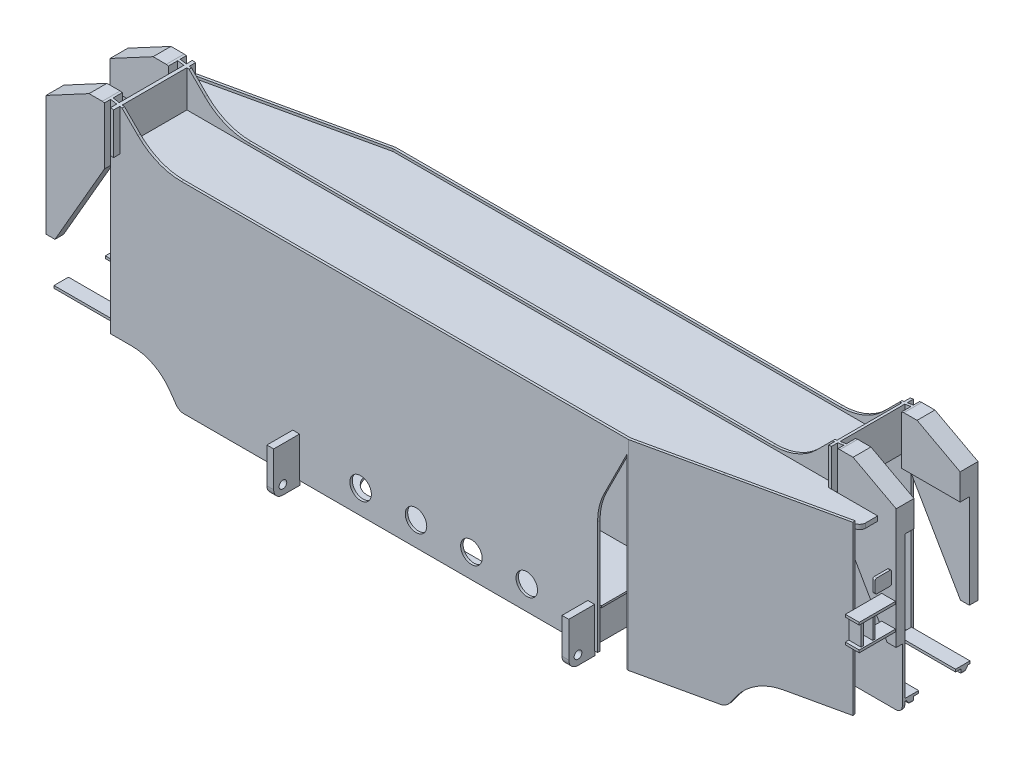
from build123d import *

# Parameters (mm, degrees)
EXTRUDE_1_DEPTH      = 8
SKETCH_4_R           = 35.00000000000003
SKETCH_4_R_2         = 34.99999999999992
SKETCH_4_R_3         = 20.250000000000004
SKETCH_4_R_4         = 20.24999999999988
SKETCH_4_R_5         = 10.499999999999998
SKETCH_4_R_6         = 10.499999999999954
CUT_EXTRUDE_2_DEPTH  = 8
EXTRUDE_2_DEPTH      = 8
SKETCH_8_R           = 34.99999999999992
CUT_EXTRUDE_4_DEPTH  = 8
EXTRUDE_3_DEPTH      = 8
SKETCH_12_R          = 34.99999999999992
CUT_EXTRUDE_6_DEPTH  = 8
EXTRUDE_4_DEPTH      = 650
EXTRUDE_5_DEPTH      = 650
EXTRUDE_6_DEPTH      = 15
EXTRUDE_7_DEPTH      = 15
SKETCH_20_W          = 1294.5
SKETCH_20_H          = 210.00000000000003
EXTRUDE_8_DEPTH      = 8
SKETCH_22_R          = 60.00000000000006
SKETCH_22_R_2        = 59.99999999999983
CUT_EXTRUDE_8_DEPTH  = 8
SKETCH_23_W          = 1294.5000000000002
SKETCH_23_H          = 210.00000000000003
EXTRUDE_9_DEPTH      = 8
SKETCH_24_R          = 60.00000000000006
SKETCH_24_R_2        = 59.99999999999994
CUT_EXTRUDE_9_DEPTH  = 8
SKETCH_26_W          = 944.0000000000002
SKETCH_26_H          = 210.00000000000003
EXTRUDE_10_DEPTH     = 6
SKETCH_27_W          = 944.0000000000001
SKETCH_27_H          = 210.00000000000003
EXTRUDE_11_DEPTH     = 6
EXTRUDE_12_DEPTH     = 20
EXTRUDE_13_DEPTH     = 20
EXTRUDE_14_DEPTH     = 20
EXTRUDE_15_DEPTH     = 20
EXTRUDE_16_DEPTH     = 8
EXTRUDE_17_DEPTH     = 8
EXTRUDE_18_DEPTH     = 30
EXTRUDE_19_DEPTH     = 30
EXTRUDE_20_DEPTH     = 30
EXTRUDE_21_DEPTH     = 30
EXTRUDE_22_DEPTH     = 346.3065
CUT_EXTRUDE_11_DEPTH = 12
EXTRUDE_23_DEPTH     = 346.3065
CUT_EXTRUDE_12_DEPTH = 12
SKETCH_51_W          = 190
SKETCH_51_H          = 46.99999999999997
SKETCH_51_H_2        = 47
SKETCH_51_W_2        = 617.2920000000001
EXTRUDE_24_DEPTH     = 8
SKETCH_52_W          = 617.2919999999997
SKETCH_52_H          = 47.00000000000003
SKETCH_52_H_2        = 47
SKETCH_52_W_2        = 190
EXTRUDE_25_DEPTH     = 8
EXTRUDE_26_DEPTH     = 319
EXTRUDE_27_DEPTH     = 319
EXTRUDE_28_DEPTH     = 319
EXTRUDE_29_DEPTH     = 319
SKETCH_60_W          = 2705
SKETCH_60_H          = 940.0000000000001
CUT_EXTRUDE_14_DEPTH = 600
SKETCH_62_W          = 214.00000000000003
SKETCH_62_H          = 109
EXTRUDE_30_DEPTH     = 22
SKETCH_64_R          = 12.499999999999956
CUT_EXTRUDE_16_DEPTH = 22
SKETCH_66_W          = 214.00000000000003
SKETCH_66_H          = 109
EXTRUDE_31_DEPTH     = 22
SKETCH_68_R          = 12.499999999999956
CUT_EXTRUDE_18_DEPTH = 22
SKETCH_70_W          = 118.00000000000001
SKETCH_70_H          = 8
EXTRUDE_32_DEPTH     = 45
SKETCH_72_W          = 8
SKETCH_72_H          = 70.00000000000006
EXTRUDE_33_DEPTH     = 40
SKETCH_74_W          = 118
SKETCH_74_H          = 8
EXTRUDE_34_DEPTH     = 45
SKETCH_75_W          = 8
SKETCH_75_H          = 70.00000000000006
EXTRUDE_35_DEPTH     = 40
EXTRUDE_36_DEPTH     = 8
EXTRUDE_37_DEPTH     = 8
EXTRUDE_38_DEPTH     = 266
EXTRUDE_39_DEPTH     = 266
EXTRUDE_40_DEPTH     = 188
EXTRUDE_41_DEPTH     = 188


with BuildPart() as part:
    # ｽｹｯﾁ2 → ﾎﾞｽ - 押し出し1 (new body)
    with BuildSketch(Plane.XY.offset(238.00000000000003)):
        with BuildLine():
            Line((20, 120), (259.781, 119.99984090816461))
            ThreePointArc((259.781, 119.99984090816461), (329.13643335766926, 103.00291777342554), (382.77413044815745, 55.86409106860222))
            Line((382.77413044815745, 55.86409106860222), (403.045155312411, 26.82710842636012))
            ThreePointArc((403.045155312411, 26.82710842636012), (413.7727822282328, 17.399235302489387), (427.644, 13.999810584529278))
            Line((427.644, 13.999810584529278), (2117.3560000000007, 13.999810584529397))
            ThreePointArc((2117.3560000000007, 13.999810584529397), (2131.2272177717678, 17.399235302489362), (2141.9548446875892, 26.82710842636005))
            Line((2141.9548446875892, 26.82710842636005), (2162.2258695518426, 55.86409106860221))
            ThreePointArc((2162.2258695518426, 55.86409106860221), (2215.8635666423306, 103.00291777342554), (2285.219, 119.99984090816457))
            Line((2285.219, 119.99984090816457), (2525, 120))
            ThreePointArc((2525, 120), (2539.142135623731, 125.85786437626905), (2545, 140))
            Line((2545, 140), (2545, 315.36))
            Line((2545, 315.36), (2545, 706))
            Line((2545, 706), (2405.0000000000005, 781))
            Line((2405.0000000000005, 781), (2362, 781))
            Line((2362, 781), (2318, 774))
            Line((2318, 774), (2266.5789281179586, 722.5790718815332))
            ThreePointArc((2266.5789281179586, 722.5790718815332), (2201.6940520156163, 679.2241348789069), (2125.157, 663.9998983438016))
            Line((2125.157, 663.9998983438016), (419.843, 663.9998983438016))
            ThreePointArc((419.843, 663.9998983438016), (343.3059479843835, 679.2241348789066), (278.4210718820413, 722.5790718815332))
            Line((278.4210718820413, 722.5790718815332), (227, 774))
            Line((227, 774), (183, 781))
            Line((183, 781), (140, 781))
            Line((140, 781), (0, 706))
            Line((0, 706), (0, 315.36))
            Line((0, 315.36), (0, 140))
            ThreePointArc((0, 140), (5.857864376269045, 125.85786437626905), (20, 120))
        make_face()
    extrude(amount=EXTRUDE_1_DEPTH)

    # ｽｹｯﾁ4 → ｶｯﾄ - 押し出し2 (cut)
    with BuildSketch(Plane.XY.offset(238.00000000000003)):
        with Locations((972.5, 92)):
            Circle(SKETCH_4_R)
        with Locations((1272.5, 92)):
            Circle(SKETCH_4_R_2)
        with Locations((1572.5, 92)):
            Circle(SKETCH_4_R_2)
        with Locations((50, 499)):
            Circle(SKETCH_4_R_3)
        with Locations((2495, 499)):
            Circle(SKETCH_4_R_4)
        with Locations((27, 401.5)):
            Circle(SKETCH_4_R_5)
        with Locations((2518.0000000000005, 401.5)):
            Circle(SKETCH_4_R_6)
        with BuildLine():
            Line((1072.5, 297), (1472.5, 297))
            ThreePointArc((1472.5, 297), (1543.2106781186549, 326.28932188134524), (1572.5, 397))
            ThreePointArc((1572.5, 397), (1543.2106781186549, 467.71067811865476), (1472.5, 497))
            Line((1472.5, 497), (1072.5, 497))
            ThreePointArc((1072.5, 497), (1001.7893218813452, 467.71067811865476), (972.5, 397))
            ThreePointArc((972.5, 397), (1001.7893218813452, 326.28932188134524), (1072.5, 297))
        make_face()
    extrude(amount=CUT_EXTRUDE_2_DEPTH, mode=Mode.SUBTRACT)



with BuildPart() as body_2:
    # ｽｹｯﾁ6 → ﾎﾞｽ - 押し出し2 (new body)
    with BuildSketch(Plane.XY.offset(20)):
        with BuildLine():
            Line((772.5, 14), (2117.3560000000007, 13.999810584529397))
            ThreePointArc((2117.3560000000007, 13.999810584529397), (2131.2272177717678, 17.399235302489362), (2141.9548446875892, 26.82710842636005))
            Line((2141.9548446875892, 26.82710842636005), (2162.2258695518426, 55.86409106860221))
            ThreePointArc((2162.2258695518426, 55.86409106860221), (2215.8635666423306, 103.00291777342554), (2285.219, 119.99984090816457))
            Line((2285.219, 119.99984090816457), (2355, 120))
            Line((2355, 120), (2355, 779.8863636363636))
            Line((2355, 779.8863636363636), (2318, 774))
            Line((2318, 774), (2266.5789281179586, 722.5790718815332))
            ThreePointArc((2266.5789281179586, 722.5790718815332), (2201.6940520156163, 679.2241348789069), (2125.157, 663.9998983438016))
            Line((2125.157, 663.9998983438016), (672.5, 664))
            Line((672.5, 664), (672.5, 629))
            Line((672.5, 629), (751.385119099635, 471.2290595501503))
            ThreePointArc((751.385119099635, 471.2290595501503), (767.1496169235868, 427.73677114133346), (772.4998668424115, 381.786))
            Line((772.4998668424115, 381.786), (772.5, 14))
        make_face()
    extrude(amount=EXTRUDE_2_DEPTH)

    # ｽｹｯﾁ8 → ｶｯﾄ - 押し出し4 (cut)
    with BuildSketch(Plane.XY.offset(20)):
        with Locations((1002.5, 92)):
            Circle(SKETCH_8_R)
        with Locations((1182.5, 92)):
            Circle(SKETCH_8_R)
        with Locations((1362.5, 92)):
            Circle(SKETCH_8_R)
        with Locations((1542.5, 92)):
            Circle(SKETCH_8_R)
    extrude(amount=CUT_EXTRUDE_4_DEPTH, mode=Mode.SUBTRACT)

    # ｽｹｯﾁ14 → ﾎﾞｽ - 押し出し4 (add)
    with BuildSketch(Plane(origin=(0, 14, 0), x_dir=(1, 0, 0), z_dir=(0, 1, 0))):
        Polygon((678.3593636567547, -26.708544411177083), (75.7, -159.54), (73.97805921490279, -151.72751512432703), (671.628819639096, -20), (676.8807411167978, -20), align=None)
    extrude(amount=EXTRUDE_4_DEPTH)


with BuildPart() as body_3:
    # ｽｹｯﾁ10 → ﾎﾞｽ - 押し出し3 (new body)
    with BuildSketch(Plane.XY.offset(456)):
        with BuildLine():
            Line((1772.5, 14), (1772.5001331575886, 381.786))
            ThreePointArc((1772.5001331575886, 381.786), (1777.8503830764132, 427.73677114133346), (1793.6148809003653, 471.2290595501503))
            Line((1793.6148809003653, 471.2290595501503), (1872.5, 629))
            Line((1872.5, 629), (1872.5, 664))
            Line((1872.5, 664), (419.84299999999985, 663.9998983438016))
            ThreePointArc((419.84299999999985, 663.9998983438016), (343.3059479843834, 679.2241348789066), (278.42107188204136, 722.5790718815332))
            Line((278.42107188204136, 722.5790718815332), (227, 774))
            Line((227, 774), (190, 779.8863636363636))
            Line((190, 779.8863636363636), (190, 120))
            Line((190, 120), (259.78099999999995, 119.99984090816457))
            ThreePointArc((259.78099999999995, 119.99984090816457), (329.1364333576692, 103.00291777342548), (382.7741304481574, 55.86409106860221))
            Line((382.7741304481574, 55.86409106860221), (403.04515531241077, 26.82710842636005))
            ThreePointArc((403.04515531241077, 26.82710842636005), (413.7727822282326, 17.399235302489338), (427.6439999999998, 13.999810584529397))
            Line((427.6439999999998, 13.999810584529397), (1772.5, 14))
        make_face()
    extrude(amount=EXTRUDE_3_DEPTH)

    # ｽｹｯﾁ12 → ｶｯﾄ - 押し出し6 (cut)
    with BuildSketch(Plane.XY.offset(456)):
        with Locations((1002.5, 92)):
            Circle(SKETCH_12_R)
        with Locations((1182.5, 92)):
            Circle(SKETCH_12_R)
        with Locations((1362.5, 92)):
            Circle(SKETCH_12_R)
        with Locations((1542.5, 92)):
            Circle(SKETCH_12_R)
    extrude(amount=CUT_EXTRUDE_6_DEPTH, mode=Mode.SUBTRACT)

    # ｽｹｯﾁ15 → ﾎﾞｽ - 押し出し5 (add)
    with BuildSketch(Plane(origin=(0, 14, 0), x_dir=(1, 0, 0), z_dir=(0, 1, 0))):
        Polygon((1866.6406363432452, -457.29145558882294), (2469.3, -324.46), (2471.0219407850973, -332.27248487567294), (1873.3711803609042, -464), (1868.119258883202, -464), align=None)
    extrude(amount=EXTRUDE_5_DEPTH)


with BuildPart() as part_1:
    add(part.part)

    add(body_2.part)  # ﾎﾞｽ - 押し出し6 merges body 2
    # ｽｹｯﾁ17 → ﾎﾞｽ - 押し出し6 (add)
    with BuildSketch(Plane(origin=(0, 641, 0), x_dir=(1, 0, 0), z_dir=(0, 1, 0))):
        with BuildLine():
            Line((672.5, -28), (75.72055662145588, -159.53254147114276))
            ThreePointArc((75.72055662145588, -159.53254147114276), (64.41628932700453, -166.53198258009726), (59.99739828844515, -179.072))
            Line((59.99739828844515, -179.072), (60, -218))
            Line((60, -218), (220, -218))
            Line((220, -218), (220, -238.00000000000003))
            Line((220, -238.00000000000003), (2325, -238.00000000000003))
            Line((2325, -238.00000000000003), (2325, -28))
            Line((2325, -28), (672.5, -28))
        make_face()
    extrude(amount=EXTRUDE_6_DEPTH)


    add(body_3.part)  # ﾎﾞｽ - 押し出し7 merges body 3
    # ｽｹｯﾁ18 → ﾎﾞｽ - 押し出し7 (add)
    with BuildSketch(Plane(origin=(0, 641, 0), x_dir=(1, 0, 0), z_dir=(0, 1, 0))):
        with BuildLine():
            Line((1872.5, -456), (2469.2794433785443, -324.46745852885726))
            ThreePointArc((2469.2794433785443, -324.46745852885726), (2480.5837106729955, -317.4680174199027), (2485.002601711555, -304.928))
            Line((2485.002601711555, -304.928), (2485, -266))
            Line((2485, -266), (2325, -266))
            Line((2325, -266), (2325, -246))
            Line((2325, -246), (220, -246))
            Line((220, -246), (220, -456))
            Line((220, -456), (1872.5, -456))
        make_face()
    extrude(amount=EXTRUDE_7_DEPTH)

    # ｽｹｯﾁ20 → ﾎﾞｽ - 押し出し8 (add)
    with BuildSketch(Plane(origin=(0, 22, 0), x_dir=(1, 0, 0), z_dir=(0, 1, 0))):
        with Locations((1451.25, -133.00000000000003)):
            Rectangle(SKETCH_20_W, SKETCH_20_H)
    extrude(amount=EXTRUDE_8_DEPTH)

    # ｽｹｯﾁ22 → ｶｯﾄ - 押し出し8 (cut)
    with BuildSketch(Plane(origin=(0, 22, 0), x_dir=(1, 0, 0), z_dir=(0, 1, 0))):
        with Locations((972, -133)):
            Circle(SKETCH_22_R)
        with Locations((1572, -133)):
            Circle(SKETCH_22_R)
        with Locations((1942, -133)):
            Circle(SKETCH_22_R_2)
        with BuildLine():
            Line((1202, -73), (1342, -73))
            ThreePointArc((1342, -73), (1384.4264068711927, -90.57359312880715), (1402.0000000000002, -133))
            ThreePointArc((1402.0000000000002, -133), (1384.426406871193, -175.42640687119302), (1342, -193))
            Line((1342, -193), (1202, -193))
            ThreePointArc((1202, -193), (1159.5735931288073, -175.42640687119285), (1142.0000000000002, -133))
            ThreePointArc((1142.0000000000002, -133), (1159.5735931288073, -90.5735931288073), (1202, -73))
        make_face()
    extrude(amount=CUT_EXTRUDE_8_DEPTH, mode=Mode.SUBTRACT)

    # ｽｹｯﾁ23 → ﾎﾞｽ - 押し出し9 (add)
    with BuildSketch(Plane(origin=(0, 22, 0), x_dir=(1, 0, 0), z_dir=(0, 1, 0))):
        with Locations((1093.7500000000002, -351.00000000000006)):
            Rectangle(SKETCH_23_W, SKETCH_23_H)
    extrude(amount=EXTRUDE_9_DEPTH)

    # ｽｹｯﾁ24 → ｶｯﾄ - 押し出し9 (cut)
    with BuildSketch(Plane(origin=(0, 22, 0), x_dir=(1, 0, 0), z_dir=(0, 1, 0))):
        with Locations((603, -351.00000000000006)):
            Circle(SKETCH_24_R)
        with Locations((973, -351.00000000000006)):
            Circle(SKETCH_24_R_2)
        with Locations((1573, -351.00000000000006)):
            Circle(SKETCH_24_R)
        with BuildLine():
            Line((1203, -291), (1343, -291))
            ThreePointArc((1343, -291), (1385.426406871193, -308.57359312880715), (1403, -351.00000000000006))
            ThreePointArc((1403, -351.00000000000006), (1385.4264068711927, -393.4264068711929), (1343, -411.00000000000006))
            Line((1343, -411.00000000000006), (1203, -411.00000000000006))
            ThreePointArc((1203, -411.00000000000006), (1160.5735931288073, -393.4264068711929), (1143, -351.00000000000006))
            ThreePointArc((1143, -351.00000000000006), (1160.5735931288073, -308.5735931288072), (1203, -291))
        make_face()
    extrude(amount=CUT_EXTRUDE_9_DEPTH, mode=Mode.SUBTRACT)

    # ｽｹｯﾁ26 → ﾎﾞｽ - 押し出し10 (add)
    with BuildSketch(Plane(origin=(0, 138, 0), x_dir=(1, 0, 0), z_dir=(0, 1, 0))):
        with Locations((1240, -133.00000000000003)):
            Rectangle(SKETCH_26_W, SKETCH_26_H)
    extrude(amount=EXTRUDE_10_DEPTH)

    # ｽｹｯﾁ27 → ﾎﾞｽ - 押し出し11 (add)
    with BuildSketch(Plane(origin=(0, 138, 0), x_dir=(1, 0, 0), z_dir=(0, 1, 0))):
        with Locations((1305.0000000000002, -351.00000000000006)):
            Rectangle(SKETCH_27_W, SKETCH_27_H)
    extrude(amount=EXTRUDE_11_DEPTH)

    # ｽｹｯﾁ29 → ﾎﾞｽ - 押し出し12 (add)
    with BuildSketch(Plane.XY.offset(218)):
        Polygon((0, 315.36), (29.105181682773434, 315.36), (190, 594.038), (190, 779.8863636363636), (183, 781), (140, 781), (0, 706), align=None)
    extrude(amount=EXTRUDE_12_DEPTH)

    # ｽｹｯﾁ34 → ﾎﾞｽ - 押し出し15 (add)
    with BuildSketch(Plane.XY.offset(246)):
        Polygon((2545, 315.36), (2545, 706), (2405.0000000000005, 781), (2362, 781), (2355, 779.8863636363636), (2355, 594.038), (2515.8948183172265, 315.36), align=None)
    extrude(amount=EXTRUDE_15_DEPTH)



with BuildPart() as body_2_2:
    # ｽｹｯﾁ31 → ﾎﾞｽ - 押し出し13 (new body)
    with BuildSketch(Plane.XY.offset(464)):
        Polygon((0, 315.36), (29.105181682773434, 315.36), (190, 594.038), (190, 779.8863636363636), (183, 781), (140, 781), (0, 706), align=None)
    extrude(amount=EXTRUDE_13_DEPTH)


with BuildPart() as body_3_2:
    # ｽｹｯﾁ32 → ﾎﾞｽ - 押し出し14 (new body)
    with BuildSketch(Plane.XY):
        Polygon((2545, 315.36), (2545, 706), (2405.0000000000005, 781), (2362, 781), (2355, 779.8863636363636), (2355, 594.038), (2515.8948183172265, 315.36), align=None)
    extrude(amount=EXTRUDE_14_DEPTH)


with BuildPart() as part_2:
    add(part_1.part)

    add(body_3_2.part)  # ﾎﾞｽ - 押し出し16 merges body 3 2
    # ｽｹｯﾁ35 → ﾎﾞｽ - 押し出し16 (add)
    with BuildSketch(Plane.XY.offset(20)):
        Polygon((2545, 315.36), (2545, 706), (2405.0000000000005, 781), (2362, 781), (2355, 779.8863636363636), (2355, 594.038), (2515.8948183172265, 315.36), align=None)
    extrude(amount=EXTRUDE_16_DEPTH)


    add(body_2_2.part)  # ﾎﾞｽ - 押し出し17 merges body 2 2
    # ｽｹｯﾁ36 → ﾎﾞｽ - 押し出し17 (add)
    with BuildSketch(Plane.XY.offset(456)):
        Polygon((0, 315.36), (29.105181682773434, 315.36), (190, 594.038), (190, 779.8863636363636), (183, 781), (140, 781), (0, 706), align=None)
    extrude(amount=EXTRUDE_17_DEPTH)

    # ｽｹｯﾁ37 → ﾎﾞｽ - 押し出し18 (add)
    with BuildSketch(Plane.XY.offset(246)):
        Polygon((0, 620.82), (190, 620.82), (190, 779.8863636363636), (183, 781), (140, 781), (0, 706), align=None)
    extrude(amount=EXTRUDE_18_DEPTH)

    # ｽｹｯﾁ39 → ﾎﾞｽ - 押し出し19 (add)
    with BuildSketch(Plane.XY.offset(426)):
        Polygon((0, 620.82), (190, 620.82), (190, 779.8863636363636), (183, 781), (140, 781), (0, 706), align=None)
    extrude(amount=EXTRUDE_19_DEPTH)

    # ｽｹｯﾁ41 → ﾎﾞｽ - 押し出し20 (add)
    with BuildSketch(Plane.XY.offset(28)):
        Polygon((2545, 620.82), (2545, 706), (2405.0000000000005, 781), (2362, 781), (2355, 779.8863636363636), (2355, 620.82), align=None)
    extrude(amount=EXTRUDE_20_DEPTH)

    # ｽｹｯﾁ43 → ﾎﾞｽ - 押し出し21 (add)
    with BuildSketch(Plane.XY.offset(208.00000000000003)):
        Polygon((2545, 620.82), (2545, 706), (2405.0000000000005, 781), (2362, 781), (2355, 779.8863636363636), (2355, 620.82), align=None)
    extrude(amount=EXTRUDE_21_DEPTH)



with BuildPart() as body_2_3:
    # ｽｹｯﾁ44 → ﾎﾞｽ - 押し出し22 (new body)
    with BuildSketch(Plane(origin=(0, 0, 0), x_dir=(0, 0, -1), z_dir=(1, 0, 0))):
        Polygon((-251.6, 150), (-450.4, 150), (-450.4, 149), (-442.698, 138), (-259.302, 138), (-251.6, 149), align=None)
    extrude(amount=EXTRUDE_22_DEPTH)

    # ｽｹｯﾁ46 → ｶｯﾄ - 押し出し11 (cut)
    with BuildSketch(Plane(origin=(0, 138, 0), x_dir=(1, 0, 0), z_dir=(0, 1, 0))):
        with BuildLine():
            Line((-10, -273.77099999999996), (155, -273.77099999999996))
            ThreePointArc((155, -273.77099999999996), (183.2842712474619, -285.48672875253806), (195, -313.77099999999996))
            Line((195, -313.77099999999996), (195, -388.22900000000004))
            ThreePointArc((195, -388.22900000000004), (183.2842712474619, -416.51327124746194), (155, -428.22900000000004))
            Line((155, -428.22900000000004), (-10, -428.22900000000004))
            Line((-10, -428.22900000000004), (-10, -273.77099999999996))
        make_face()
    extrude(amount=CUT_EXTRUDE_11_DEPTH, mode=Mode.SUBTRACT)


with BuildPart() as body_3_3:
    # ｽｹｯﾁ48 → ﾎﾞｽ - 押し出し23 (new body)
    with BuildSketch(Plane(origin=(2545, 0, 0), x_dir=(0, 0, -1), z_dir=(1, 0, 0))):
        Polygon((-232.40000000000003, 150), (-232.40000000000003, 149), (-224.69799999999998, 138), (-41.30200000000002, 138), (-33.60000000000002, 149), (-33.60000000000002, 150), align=None)
    extrude(amount=-EXTRUDE_23_DEPTH)

    # ｽｹｯﾁ49 → ｶｯﾄ - 押し出し12 (cut)
    with BuildSketch(Plane(origin=(0, 138, 0), x_dir=(1, 0, 0), z_dir=(0, 1, 0))):
        with BuildLine():
            Line((2555, -210.22900000000004), (2390, -210.22900000000004))
            ThreePointArc((2390, -210.22900000000004), (2361.7157287525383, -198.51327124746194), (2350, -170.22900000000004))
            Line((2350, -170.22900000000004), (2350, -95.77099999999996))
            ThreePointArc((2350, -95.77099999999996), (2361.7157287525383, -67.48672875253806), (2390, -55.77099999999996))
            Line((2390, -55.77099999999996), (2555, -55.77099999999996))
            Line((2555, -55.77099999999996), (2555, -210.22900000000004))
        make_face()
    extrude(amount=CUT_EXTRUDE_12_DEPTH, mode=Mode.SUBTRACT)


with BuildPart() as part_3:
    add(part_2.part)

    add(body_2_3.part)  # ﾎﾞｽ - 押し出し24 merges body 2 3
    # ｽｹｯﾁ51 → ﾎﾞｽ - 押し出し24 (add)
    with BuildSketch(Plane(origin=(0, 150, 0), x_dir=(1, 0, 0), z_dir=(0, 1, 0))):
        with Locations((95, -267.5)):
            Rectangle(SKETCH_51_W, SKETCH_51_H)
        with Locations((95, -434.50000000000006)):
            Rectangle(SKETCH_51_W, SKETCH_51_H_2)
        with Locations((524.354, -267.5)):
            Rectangle(SKETCH_51_W_2, SKETCH_51_H)
        with Locations((524.354, -434.50000000000006)):
            Rectangle(SKETCH_51_W_2, SKETCH_51_H_2)
    extrude(amount=EXTRUDE_24_DEPTH)


    add(body_3_3.part)  # ﾎﾞｽ - 押し出し25 merges body 3 3
    # ｽｹｯﾁ52 → ﾎﾞｽ - 押し出し25 (add)
    with BuildSketch(Plane(origin=(0, 150, 0), x_dir=(1, 0, 0), z_dir=(0, 1, 0))):
        with Locations((2020.6460000000002, -216.5)):
            Rectangle(SKETCH_52_W, SKETCH_52_H)
        with Locations((2020.6460000000002, -49.5)):
            Rectangle(SKETCH_52_W, SKETCH_52_H_2)
        with Locations((2450, -216.5)):
            Rectangle(SKETCH_52_W_2, SKETCH_52_H)
        with Locations((2450, -49.5)):
            Rectangle(SKETCH_52_W_2, SKETCH_52_H_2)
    extrude(amount=EXTRUDE_25_DEPTH)

    # ｽｹｯﾁ54 → ﾎﾞｽ - 押し出し26 (add)
    with BuildSketch(Plane(origin=(1771.5, 0, 0), x_dir=(0, 0, -1), z_dir=(1, 0, 0))):
        Polygon((-28, 30), (-40.32, 29.97), (-63.75, 129.12), (-53.54, 138), align=None)
    extrude(amount=EXTRUDE_26_DEPTH)

    # ｽｹｯﾁ55 → ﾎﾞｽ - 押し出し27 (add)
    with BuildSketch(Plane(origin=(1771.5, 0, 0), x_dir=(0, 0, -1), z_dir=(1, 0, 0))):
        Polygon((-212.46, 138), (-202.25, 129.12), (-225.68, 29.97), (-238.00000000000003, 30), align=None)
    extrude(amount=EXTRUDE_27_DEPTH)

    # ｽｹｯﾁ57 → ﾎﾞｽ - 押し出し28 (add)
    with BuildSketch(Plane(origin=(454.5, 0, 0), x_dir=(0, 0, -1), z_dir=(1, 0, 0))):
        Polygon((-430.46000000000004, 138), (-420.25, 129.12), (-443.68, 29.97), (-456, 30), align=None)
    extrude(amount=EXTRUDE_28_DEPTH)

    # ｽｹｯﾁ58 → ﾎﾞｽ - 押し出し29 (add)
    with BuildSketch(Plane(origin=(454.5, 0, 0), x_dir=(0, 0, -1), z_dir=(1, 0, 0))):
        Polygon((-246, 30), (-258.32, 29.97), (-281.75, 129.12), (-271.53999999999996, 138), align=None)
    extrude(amount=EXTRUDE_29_DEPTH)

    # ｽｹｯﾁ60 → ｶｯﾄ - 押し出し14 (cut)
    with BuildSketch(Plane.XY):
        with Locations((1272.5, 390.00000000000006)):
            Rectangle(SKETCH_60_W, SKETCH_60_H)
        with BuildLine():
            Line((20, 120), (259.781, 119.99984090816461))
            ThreePointArc((259.781, 119.99984090816461), (329.13643335766926, 103.00291777342554), (382.77413044815745, 55.86409106860222))
            Line((382.77413044815745, 55.86409106860222), (403.045155312411, 26.82710842636012))
            ThreePointArc((403.045155312411, 26.82710842636012), (413.7727822282328, 17.399235302489387), (427.644, 13.999810584529278))
            Line((427.644, 13.999810584529278), (2117.3560000000007, 13.999810584529397))
            ThreePointArc((2117.3560000000007, 13.999810584529397), (2131.2272177717678, 17.399235302489362), (2141.9548446875892, 26.82710842636005))
            Line((2141.9548446875892, 26.82710842636005), (2162.2258695518426, 55.86409106860221))
            ThreePointArc((2162.2258695518426, 55.86409106860221), (2215.8635666423306, 103.00291777342554), (2285.219, 119.99984090816457))
            Line((2285.219, 119.99984090816457), (2525, 120))
            ThreePointArc((2525, 120), (2539.142135623731, 125.85786437626905), (2545, 140))
            Line((2545, 140), (2545, 315.36))
            Line((2545, 315.36), (2545, 706))
            Line((2545, 706), (2405.0000000000005, 781))
            Line((2405.0000000000005, 781), (2362, 781))
            Line((2362, 781), (2318, 774))
            Line((2318, 774), (2266.5789281179586, 722.5790718815332))
            ThreePointArc((2266.5789281179586, 722.5790718815332), (2201.6940520156163, 679.2241348789069), (2125.157, 663.9998983438016))
            Line((2125.157, 663.9998983438016), (419.843, 663.9998983438016))
            ThreePointArc((419.843, 663.9998983438016), (343.3059479843835, 679.2241348789066), (278.4210718820413, 722.5790718815332))
            Line((278.4210718820413, 722.5790718815332), (227, 774))
            Line((227, 774), (183, 781))
            Line((183, 781), (140, 781))
            Line((140, 781), (0, 706))
            Line((0, 706), (0, 315.36))
            Line((0, 315.36), (0, 140))
            ThreePointArc((0, 140), (5.857864376269045, 125.85786437626905), (20, 120))
        make_face(mode=Mode.SUBTRACT)
    extrude(amount=CUT_EXTRUDE_14_DEPTH, mode=Mode.SUBTRACT)

    # ｽｹｯﾁ62 → ﾎﾞｽ - 押し出し30 (add)
    with BuildSketch(Plane(origin=(782, 0, 0), x_dir=(0, 0, -1), z_dir=(1, 0, 0))):
        with Locations((-133.00000000000003, 83.5)):
            Rectangle(SKETCH_62_W, SKETCH_62_H)
        with Locations((-351.00000000000006, 83.5)):
            Rectangle(SKETCH_62_W, SKETCH_62_H)
        with BuildLine():
            Line((-462, 0), (-518, 0))
            ThreePointArc((-518, 0), (-539.2132034355964, 8.786796564403573), (-548, 30))
            Line((-548, 30), (-548, 145))
            Line((-548, 145), (-462, 145))
            Line((-462, 145), (-462, 0))
        make_face()
    extrude(amount=EXTRUDE_30_DEPTH)

    # ｽｹｯﾁ64 → ｶｯﾄ - 押し出し16 (cut)
    with BuildSketch(Plane(origin=(782, 0, 0), x_dir=(0, 0, -1), z_dir=(1, 0, 0))):
        with Locations((-518, 30)):
            Circle(SKETCH_64_R)
    extrude(amount=CUT_EXTRUDE_16_DEPTH, mode=Mode.SUBTRACT)

    # ｽｹｯﾁ66 → ﾎﾞｽ - 押し出し31 (add)
    with BuildSketch(Plane(origin=(1741, 0, 0), x_dir=(0, 0, -1), z_dir=(1, 0, 0))):
        with Locations((-133.00000000000003, 83.5)):
            Rectangle(SKETCH_66_W, SKETCH_66_H)
        with Locations((-351.00000000000006, 83.5)):
            Rectangle(SKETCH_66_W, SKETCH_66_H)
        with BuildLine():
            Line((-462, 0), (-518, 0))
            ThreePointArc((-518, 0), (-539.2132034355964, 8.786796564403573), (-548, 30))
            Line((-548, 30), (-548, 145))
            Line((-548, 145), (-462, 145))
            Line((-462, 145), (-462, 0))
        make_face()
    extrude(amount=EXTRUDE_31_DEPTH)

    # ｽｹｯﾁ68 → ｶｯﾄ - 押し出し18 (cut)
    with BuildSketch(Plane(origin=(1741, 0, 0), x_dir=(0, 0, -1), z_dir=(1, 0, 0))):
        with Locations((-518, 30)):
            Circle(SKETCH_68_R)
    extrude(amount=CUT_EXTRUDE_18_DEPTH, mode=Mode.SUBTRACT)

    # ｽｹｯﾁ70 → ﾎﾞｽ - 押し出し32 (add)
    with BuildSketch(Plane(origin=(2, 0, 0), x_dir=(0, 0, -1), z_dir=(1, 0, 0))):
        with Locations((-159.00000000000003, 362.5)):
            Rectangle(SKETCH_70_W, SKETCH_70_H)
        with Locations((-159.00000000000003, 440.50000000000006)):
            Rectangle(SKETCH_70_W, SKETCH_70_H)
    extrude(amount=EXTRUDE_32_DEPTH)

    # ｽｹｯﾁ72 → ﾎﾞｽ - 押し出し33 (add)
    with BuildSketch(Plane(origin=(7, 0, 0), x_dir=(0, 0, -1), z_dir=(1, 0, 0))):
        with Locations((-115.00000000000001, 401.5)):
            Rectangle(SKETCH_72_W, SKETCH_72_H)
        with Locations((-153, 401.5)):
            Rectangle(SKETCH_72_W, SKETCH_72_H)
    extrude(amount=EXTRUDE_33_DEPTH)

    # ｽｹｯﾁ74 → ﾎﾞｽ - 押し出し34 (add)
    with BuildSketch(Plane(origin=(2498, 0, 0), x_dir=(0, 0, -1), z_dir=(1, 0, 0))):
        with Locations((-325, 362.5)):
            Rectangle(SKETCH_74_W, SKETCH_74_H)
        with Locations((-325, 440.50000000000006)):
            Rectangle(SKETCH_74_W, SKETCH_74_H)
    extrude(amount=EXTRUDE_34_DEPTH)

    # ｽｹｯﾁ75 → ﾎﾞｽ - 押し出し35 (add)
    with BuildSketch(Plane(origin=(2498, 0, 0), x_dir=(0, 0, -1), z_dir=(1, 0, 0))):
        with Locations((-369, 401.5)):
            Rectangle(SKETCH_75_W, SKETCH_75_H)
        with Locations((-331, 401.5)):
            Rectangle(SKETCH_75_W, SKETCH_75_H)
    extrude(amount=EXTRUDE_35_DEPTH)

    # ｽｹｯﾁ77 → ﾎﾞｽ - 押し出し36 (add)
    with BuildSketch(Plane(origin=(15, 0, 0), x_dir=(0, 0, -1), z_dir=(1, 0, 0))):
        with BuildLine():
            Line((-170, 483), (-213, 483))
            ThreePointArc((-213, 483), (-216.53553390593274, 484.46446609406723), (-218, 488))
            Line((-218, 488), (-218, 523))
            ThreePointArc((-218, 523), (-216.53553390593274, 526.5355339059328), (-213, 528))
            Line((-213, 528), (-170, 528))
            ThreePointArc((-170, 528), (-166.46446609406726, 526.5355339059328), (-165, 523))
            Line((-165, 523), (-165, 488))
            ThreePointArc((-165, 488), (-166.46446609406726, 484.4644660940673), (-170, 483))
        make_face()
    extrude(amount=EXTRUDE_36_DEPTH)

    # ｽｹｯﾁ79 → ﾎﾞｽ - 押し出し37 (add)
    with BuildSketch(Plane(origin=(2522.0000000000005, 0, 0), x_dir=(0, 0, -1), z_dir=(1, 0, 0))):
        with BuildLine():
            Line((-271, 483), (-314, 483))
            ThreePointArc((-314, 483), (-317.5355339059327, 484.46446609406723), (-319, 488))
            Line((-319, 488), (-319, 523))
            ThreePointArc((-319, 523), (-317.5355339059327, 526.5355339059328), (-314, 528))
            Line((-314, 528), (-271, 528))
            ThreePointArc((-271, 528), (-267.46446609406723, 526.5355339059328), (-266, 523))
            Line((-266, 523), (-266, 488))
            ThreePointArc((-266, 488), (-267.46446609406723, 484.4644660940673), (-271, 483))
        make_face()
    extrude(amount=EXTRUDE_37_DEPTH)

    # ｽｹｯﾁ80 → ﾎﾞｽ - 押し出し38 (add)
    with BuildSketch(Plane.XY.offset(218)):
        Polygon((210, 641), (220, 641), (220, 775.1136363636364), (210, 776.7045454545455), align=None)
    extrude(amount=EXTRUDE_38_DEPTH)

    # ｽｹｯﾁ81 → ﾎﾞｽ - 押し出し39 (add)
    with BuildSketch(Plane.XY):
        Polygon((2325, 641), (2335, 641), (2335, 776.7045454545455), (2325, 775.1136363636364), align=None)
    extrude(amount=EXTRUDE_39_DEPTH)


with BuildPart() as body_2_4:
    # ｽｹｯﾁ83 → ﾎﾞｽ - 押し出し40 (new body)
    with BuildSketch(Plane.XY.offset(257)):
        Polygon((412.1530713405246, 22.088564794701583), (421.9829286594754, 28.97143520529842), (348.6229286594754, 133.74143520529842), (338.79307134052465, 126.85856479470159), align=None)
    extrude(amount=EXTRUDE_40_DEPTH)

    # ｽｹｯﾁ85 → ｶｯﾄ - 回転1 (revolve, cut)
    with BuildSketch(Plane.XY.offset(351.00000000000006)):
        Polygon((359.9091305855192, 63.57568664458994), (400.86686941448085, 92.25431335541008), (377.9239680458247, 125.02050441857939), (336.9662292168631, 96.34187770775928), align=None)
    revolve(axis=Axis((359.9091305855192, 63.57568664458994, 351.00000000000006), (0.8191547765792332, 0.573572534216403, 0)), mode=Mode.SUBTRACT)


with BuildPart() as body_3_4:
    # ｽｹｯﾁ87 → ﾎﾞｽ - 押し出し41 (new body)
    with BuildSketch(Plane.XY.offset(39)):
        Polygon((2206.206928659475, 126.85856479470159), (2196.3770713405247, 133.74143520529842), (2123.0170713405246, 28.97143520529842), (2132.8469286594755, 22.088564794701583), align=None)
    extrude(amount=EXTRUDE_41_DEPTH)

    # ｽｹｯﾁ89 → ｶｯﾄ - 回転2 (revolve, cut)
    with BuildSketch(Plane.XY.offset(133)):
        Polygon((2185.090869414481, 63.57568664458994), (2144.133130585519, 92.25431335541008), (2121.1902292168634, 59.48812229224075), (2162.1479680458247, 30.809495581420606), align=None)
    revolve(axis=Axis((2185.090869414481, 63.57568664458994, 133), (-0.8191547765792335, 0.5735725342164025, 0)), mode=Mode.SUBTRACT)


solid = Compound([part_3.part, body_2_4.part, body_3_4.part])
